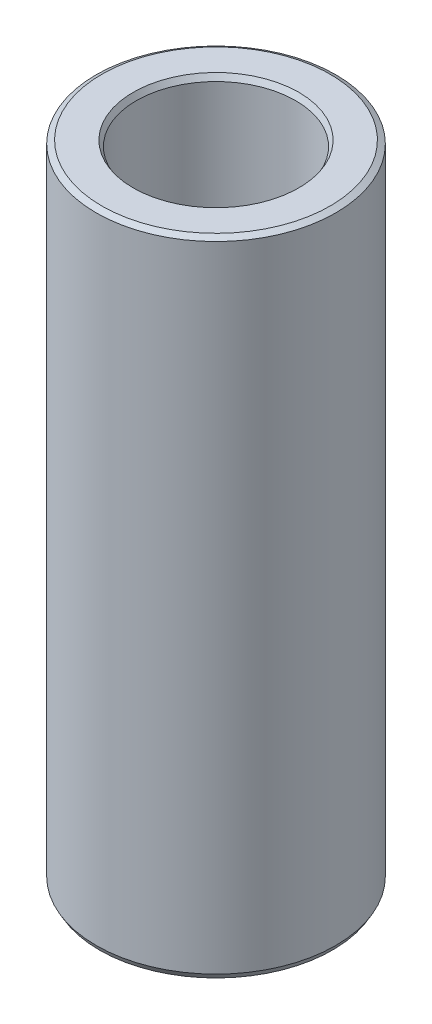
from build123d import *
from OCP.BRepFilletAPI import BRepFilletAPI_MakeChamfer

# Parameters (mm, degrees)
SKETCH1_R           = 25
BOSS_EXTRUDE1_DEPTH = 134.26983357
SKETCH2_R           = 16.627087684
CUT_EXTRUDE1_DEPTH  = 139.846635562
CHAMFER1_SIZE       = 0.664285596
CHAMFER1_SIZE2      = 1.166283261


with BuildPart() as part:
    # Sketch1 → Boss-Extrude1 (new body)
    with BuildSketch(Plane(origin=(0, 0, 0), x_dir=(1, 0, 0), z_dir=(0, 1, 0))):
        Circle(SKETCH1_R)
    extrude(amount=BOSS_EXTRUDE1_DEPTH)

    # Sketch2 → Cut-Extrude1 (cut, through all)
    with BuildSketch(Plane(origin=(0, 0, 0), x_dir=(1, 0, 0), z_dir=(0, 1, 0))):
        Circle(SKETCH2_R)
    extrude(amount=CUT_EXTRUDE1_DEPTH, mode=Mode.SUBTRACT)

    # Chamfer1: one chamfer whose edges measure the first distance from different faces: ONE call of the kernel's chamfer builder (chamfer() names one face for all edges)
    chamfer1_edges_1 = [part.edges().sort_by_distance(p)[0] for p in [
        (-16.627087684, 134.26983357, 0),
    ]]
    chamfer1_side_1 = [part.faces().sort_by_distance(p)[0] for p in [
        (-24.292893219, 134.26983357, 0),
    ]]
    chamfer1_edges_2 = [part.edges().sort_by_distance(p)[0] for p in [
        (-16.627087684, 0, 0),
    ]]
    chamfer1_side_2 = [part.faces().sort_by_distance(p)[0] for p in [
        (-16.627087684, 67.134916785, 0),
    ]]
    chamfer1_edges_3 = [part.edges().sort_by_distance(p)[0] for p in [
        (-25, 0, 0),
    ]]
    chamfer1_side_3 = [part.faces().sort_by_distance(p)[0] for p in [
        (-24.292893219, 0, 0),
    ]]
    chamfer1_edges_4 = [part.edges().sort_by_distance(p)[0] for p in [
        (-25, 134.26983357, 0),
    ]]
    chamfer1_side_4 = [part.faces().sort_by_distance(p)[0] for p in [
        (-25, 67.134916785, 0),
    ]]
    chamfer1 = BRepFilletAPI_MakeChamfer(part.part.solid().wrapped)
    for e in chamfer1_edges_1:
        chamfer1.Add(CHAMFER1_SIZE, CHAMFER1_SIZE2, e.wrapped, chamfer1_side_1[0].wrapped)  # the first distance lies on this face
    for e in chamfer1_edges_2:
        chamfer1.Add(CHAMFER1_SIZE, CHAMFER1_SIZE2, e.wrapped, chamfer1_side_2[0].wrapped)  # the first distance lies on this face
    for e in chamfer1_edges_3:
        chamfer1.Add(CHAMFER1_SIZE, CHAMFER1_SIZE2, e.wrapped, chamfer1_side_3[0].wrapped)  # the first distance lies on this face
    for e in chamfer1_edges_4:
        chamfer1.Add(CHAMFER1_SIZE, CHAMFER1_SIZE2, e.wrapped, chamfer1_side_4[0].wrapped)  # the first distance lies on this face
    add(Compound.cast(chamfer1.Shape()), mode=Mode.REPLACE)


solid = part.part
